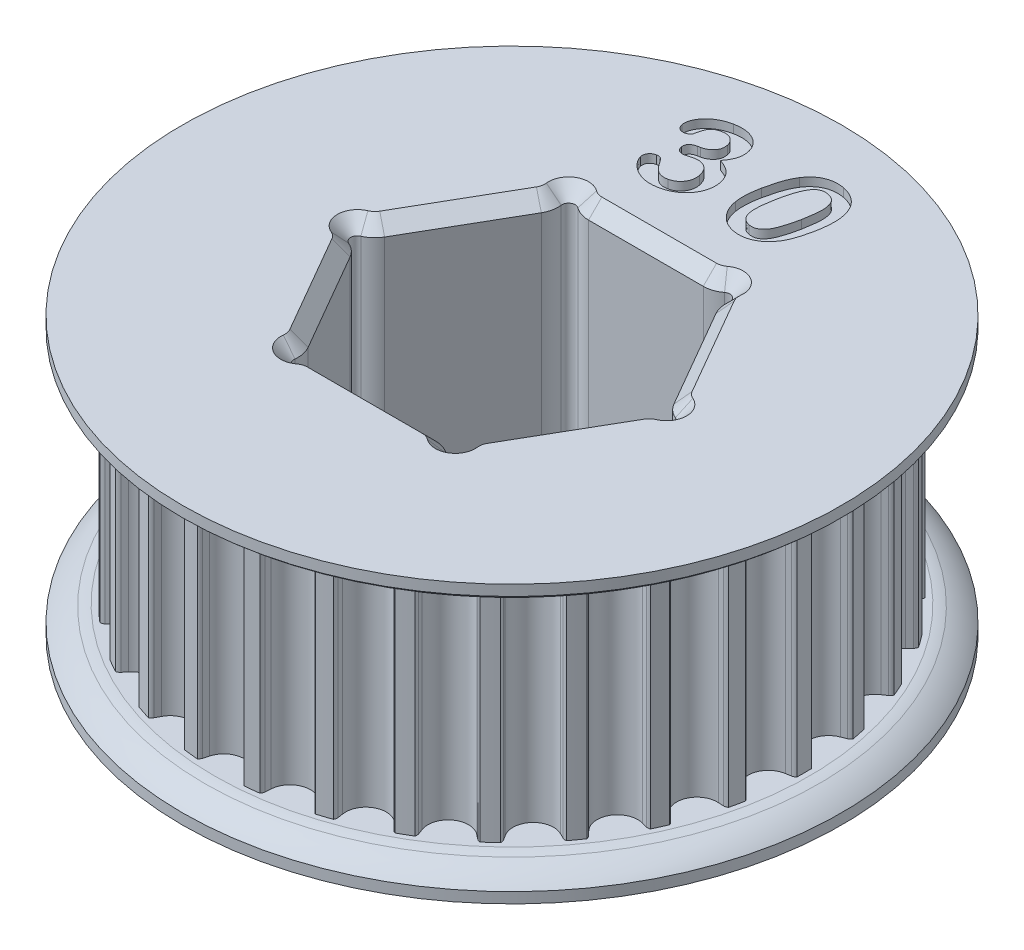
from build123d import *

# Parameters (mm, degrees)
SKETCH1_R               = 13.942945337
TOOTHOD_DEPTH           = 5.334
TOOTHPROFILE_DEPTH      = 21.427016555
TOOTHPATTERN_COUNT      = 30
BORE_DEPTH              = 24.192866588
BORE_DEPTH_BACK         = 24.192866588
LARGE_START             = 6.204
LARGE_TOOTH_COUNT_DEPTH = 0.4
SKETCH12_R              = 0.3175
CUT_EXTRUDE1_DEPTH      = 26.860153032
FILLET1_R               = 1.27
CHAMFER1_SIZE           = 0.635


# Read off the part's stored shape, not the designer's step: Large Tooth Count
with BuildPart() as part:
    # Sketch1 → ToothOD (new, symmetric)
    with BuildSketch(Plane(origin=(0, 0, 0), x_dir=(1, 0, 0), z_dir=(0, 1, 0))):
        with Locations(Location((0, 0, 0), (0, 0, 270))):
            Circle(SKETCH1_R)
    extrude(amount=TOOTHOD_DEPTH, both=True)

    # Sketch2 → ToothProfile (cut, symmetric)
    with BuildSketch(Plane(origin=(0, 0, 0), x_dir=(1, 0, 0), z_dir=(0, 1, 0))):
        with BuildLine():
            ThreePointArc((-0.937033068, 13.493007333), (-0.590385173, 12.974832723), (0, 12.774545337))
            ThreePointArc((0, 12.774545337), (0.590385173, 12.974832723), (0.937033068, 13.493007333))
            ThreePointArc((0.937033068, 13.493007333), (0.971699064, 13.619118795), (1.007805813, 13.744825337))
            ThreePointArc((1.007805813, 13.744825337), (1.04827578, 13.830028138), (1.113221937, 13.898433782))
            ThreePointArc((1.113221937, 13.898433782), (0, 13.942945337), (-1.113221937, 13.898433782))
            ThreePointArc((-1.113221937, 13.898433782), (-1.04827578, 13.830028138), (-1.007805813, 13.744825337))
            ThreePointArc((-1.007805813, 13.744825337), (-0.971699064, 13.619118795), (-0.937033068, 13.493007333))
        make_face()
    toothprofile = extrude(amount=TOOTHPROFILE_DEPTH, both=True, mode=Mode.SUBTRACT)

    # ToothPattern: ToothProfile ×30 about axis
    toothpattern_axis = Axis((0, 0, 0), (0, 1, 0))
    for i in range(1, TOOTHPATTERN_COUNT):
        add(toothprofile.rotate(toothpattern_axis, i * 360 / TOOTHPATTERN_COUNT), mode=Mode.SUBTRACT)

    # Sketch4 → Flange (revolve)
    with BuildSketch(Plane.XY, mode=Mode.PRIVATE) as flange_sk:
        with BuildLine():
            Line((0, -5.334), (14.196945337, -5.334))
            ThreePointArc((14.196945337, -5.334), (14.426591958, -5.369951298), (14.652017665, -5.426637424))
            ThreePointArc((14.652017665, -5.426637424), (15.219746242, -5.708197125), (15.720945337, -6.096))
            Line((15.720945337, -6.096), (15.720945337, -6.604))
            Line((15.720945337, -6.604), (0, -6.604))
            Line((0, -6.604), (0, -5.334))
        make_face()
        with BuildLine():
            Line((15.720945337, 6.604), (15.720945337, 6.096))
            ThreePointArc((15.720945337, 6.096), (15.219746242, 5.708197125), (14.652017665, 5.426637424))
            ThreePointArc((14.652017665, 5.426637424), (14.426591958, 5.369951298), (14.196945337, 5.334))
            Line((14.196945337, 5.334), (0, 5.334))
            Line((0, 5.334), (0, 6.604))
            Line((0, 6.604), (15.720945337, 6.604))
        make_face()
    revolve(flange_sk.sketch.rotate(Axis((0, 8.73125, 0), (0, -1, 0)), 90), axis=Axis((0, 8.73125, 0), (0, -1, 0)))

    # Sketch7 → Bore (cut, two sides: drawn at the far end of the back side and taken through both)
    with BuildSketch(Plane.XZ.offset(-BORE_DEPTH_BACK)):
        Polygon((3.688171255, 6.3881), (-3.688171255, 6.3881), (-7.376342509, 0), (-3.688171255, -6.3881), (3.688171255, -6.3881), (7.376342509, 0), align=None)
    extrude(amount=BORE_DEPTH + BORE_DEPTH_BACK, mode=Mode.SUBTRACT)

    # Large Tooth Count outline → Large Tooth Count (cut)
    # profile 1 of 2: a face of its own
    with BuildSketch(Plane(origin=(0, 0, 0), x_dir=(1, 0, 0), z_dir=(0, 1, 0)).offset(LARGE_START)):
        with BuildLine():
            add(Edge.make_bspline(
                [(3.79333125, 12.049422656), (3.80295948, 12.00370364), (3.822909298, 11.908973243), (3.839934178, 11.759322164), (3.847830972, 11.598568062), (3.845403862, 11.426870198), (3.834720655, 11.244188528), (3.813775106, 11.050562966), (3.783444974, 10.84559573), (3.75637949, 10.706002666), (3.742432031, 10.634067187)],
                knots=[0, 0, 0, 0, 0.098209665, 0.203491703, 0.316304971, 0.436495508, 0.564411761, 0.701005585, 0.845921381, 1, 1, 1, 1], degree=3))
            add(Edge.make_bspline(
                [(2.656582031, 13.166526562), (2.706206849, 13.155132675), (2.803280318, 13.132844548), (2.94259136, 13.086337807), (3.071736883, 13.028103956), (3.191370893, 12.958924604), (3.301133537, 12.879562268), (3.401403565, 12.790147143), (3.491932185, 12.691098378), (3.571195273, 12.581049527), (3.64270375, 12.462621366), (3.702802479, 12.333654233), (3.754304174, 12.195380289), (3.780133676, 12.098780354), (3.79333125, 12.049422656)],
                knots=[0, 0, 0, 0, 0.090152796, 0.176352178, 0.259651945, 0.340679802, 0.420727392, 0.499147058, 0.578272523, 0.657893561, 0.739002001, 0.822964899, 0.909543988, 1, 1, 1, 1], degree=3))
            add(Edge.make_bspline(
                [(1.173360938, 12.536090625), (1.19564708, 12.568475682), (1.239439637, 12.632112739), (1.309876572, 12.722043796), (1.385379435, 12.80326932), (1.463717976, 12.877766601), (1.546382669, 12.944036096), (1.632321887, 13.00315336), (1.721642673, 13.055310869), (1.815070316, 13.098996641), (1.911135191, 13.135579536), (2.010219263, 13.164530113), (2.111823638, 13.184843484), (2.216010824, 13.1974155), (2.322610005, 13.201900957), (2.431748708, 13.197738987), (2.543820042, 13.187862345), (2.61857504, 13.173717895), (2.656582031, 13.166526562)],
                knots=[0, 0, 0, 0, 0.068450482, 0.134506083, 0.198696985, 0.261397333, 0.32259497, 0.382979431, 0.44289939, 0.502488886, 0.562366234, 0.621745712, 0.682025526, 0.742587693, 0.804322948, 0.86759274, 0.932681402, 1, 1, 1, 1], degree=3))
            add(Edge.make_bspline(
                [(0.702766406, 11.194851563), (0.717518862, 11.26519424), (0.746304912, 11.402451919), (0.795571225, 11.601658214), (0.847978183, 11.789071165), (0.90385964, 11.964480499), (0.96446555, 12.126861213), (1.028594768, 12.276407029), (1.09639016, 12.412817483), (1.14831297, 12.495974859), (1.173360938, 12.536090625)],
                knots=[0, 0, 0, 0, 0.150859184, 0.294367262, 0.430657714, 0.559291409, 0.680684962, 0.794312984, 0.900774981, 1, 1, 1, 1], degree=3))
            add(Edge.make_bspline(
                [(0.644723437, 10.008096094), (0.638642526, 10.051800398), (0.62630634, 10.140462185), (0.615500251, 10.276683221), (0.613264488, 10.417696474), (0.617724523, 10.563713236), (0.629736602, 10.714706791), (0.647630451, 10.870765397), (0.671603874, 11.031631495), (0.692265669, 11.139851826), (0.702766406, 11.194851563)],
                knots=[0, 0, 0, 0, 0.110816528, 0.224810611, 0.342958202, 0.464879995, 0.591603543, 0.723291302, 0.859371106, 1, 1, 1, 1], degree=3))
            add(Edge.make_bspline(
                [(1.794867187, 8.76061875), (1.757796481, 8.76895007), (1.68470395, 8.785376984), (1.578692012, 8.82022096), (1.476675673, 8.860522245), (1.379895209, 8.910638347), (1.286656653, 8.96627254), (1.199065463, 9.031260904), (1.11583816, 9.102909474), (1.037001008, 9.181177406), (0.965366205, 9.26703746), (0.89879616, 9.357482146), (0.838782928, 9.453126056), (0.786187527, 9.554158241), (0.740572541, 9.660223984), (0.701101372, 9.771069082), (0.668904031, 9.887535787), (0.652864919, 9.96750406), (0.644723437, 10.008096094)],
                knots=[0, 0, 0, 0, 0.063013357, 0.124243807, 0.184962126, 0.244824632, 0.304882435, 0.36494633, 0.425537954, 0.487006996, 0.549046882, 0.61088984, 0.673245472, 0.736208478, 0.799702013, 0.864689897, 0.931316357, 1, 1, 1, 1], degree=3))
            add(Edge.make_bspline(
                [(3.180754687, 9.264253125), (3.157871319, 9.238339502), (3.112408772, 9.186856728), (3.039152131, 9.116067869), (2.9637652, 9.050064281), (2.885426692, 8.990658812), (2.8048367, 8.936587878), (2.721160657, 8.88907576), (2.63496381, 8.847278953), (2.517451736, 8.799676867), (2.365781878, 8.756326636), (2.178312896, 8.730516303), (1.986365835, 8.729537419), (1.859281577, 8.750163925), (1.794867187, 8.76061875)],
                knots=[0, 0, 0, 0, 0.066903371, 0.132917389, 0.197045886, 0.260779646, 0.323109482, 0.384791342, 0.446902374, 0.508430619, 0.630088147, 0.75110531, 0.873844332, 1, 1, 1, 1], degree=3))
            add(Edge.make_bspline(
                [(3.742432031, 10.634067187), (3.726295378, 10.558340978), (3.695171685, 10.412283466), (3.641678743, 10.203431187), (3.584650967, 10.012311882), (3.523425044, 9.837691486), (3.454100306, 9.677001753), (3.374462336, 9.528516449), (3.284684763, 9.389781631), (3.215227641, 9.305890142), (3.180754687, 9.264253125)],
                knots=[0, 0, 0, 0, 0.155098438, 0.29914731, 0.431769474, 0.554551464, 0.669651875, 0.781967595, 0.891786174, 1, 1, 1, 1], degree=3))
        make_face()
        with BuildLine():
            add(Edge.make_bspline(
                [(1.913632031, 9.391054688), (1.936191106, 9.38694552), (1.980185713, 9.37893184), (2.045763475, 9.376169625), (2.108911071, 9.377120318), (2.169393074, 9.386316528), (2.227667826, 9.401443932), (2.282542724, 9.423991977), (2.335506687, 9.451969145), (2.403091961, 9.499508781), (2.481822438, 9.575759873), (2.568295205, 9.6856682), (2.644534424, 9.81897376), (2.700601492, 9.944710055), (2.743549964, 10.056346982), (2.775688425, 10.14928192), (2.806502535, 10.249549545), (2.83842757, 10.356386286), (2.8666493, 10.470972631), (2.898301591, 10.591595098), (2.925859938, 10.719988705), (2.944440044, 10.807895221), (2.953940625, 10.852844531)],
                knots=[0, 0, 0, 0, 0.034322192, 0.066934986, 0.09817343, 0.128833214, 0.15837243, 0.188193233, 0.21752966, 0.247971246, 0.311715644, 0.380966107, 0.456937588, 0.541184412, 0.5870788, 0.636172085, 0.688515898, 0.744276078, 0.803241566, 0.865343089, 0.931145772, 1, 1, 1, 1], degree=3))
            add(Edge.make_bspline(
                [(1.519832813, 11.11805625), (1.511017323, 11.074037933), (1.493773916, 10.98793656), (1.471625542, 10.861374205), (1.452620291, 10.740537153), (1.437576544, 10.625256237), (1.425232976, 10.51569431), (1.414584888, 10.411887693), (1.409872652, 10.313826042), (1.405715218, 10.193850961), (1.409976085, 10.055502488), (1.432295682, 9.903419688), (1.467453367, 9.768934219), (1.520446003, 9.652923922), (1.590923619, 9.555124537), (1.681918125, 9.47873684), (1.790886115, 9.421901023), (1.871680589, 9.401597183), (1.913632031, 9.391054688)],
                knots=[0, 0, 0, 0, 0.068200355, 0.133402288, 0.195185331, 0.254025261, 0.31000668, 0.362698789, 0.412516234, 0.459113992, 0.545092877, 0.622348653, 0.692232855, 0.755558915, 0.815072705, 0.873785642, 0.934464896, 1, 1, 1, 1], degree=3))
            add(Edge.make_bspline(
                [(2.542282031, 12.535197656), (2.510228965, 12.540610223), (2.447897413, 12.551135695), (2.355155361, 12.55080467), (2.267169473, 12.538045332), (2.185158847, 12.509404991), (2.107646091, 12.469091598), (2.037103622, 12.413069325), (1.969950233, 12.345664248), (1.909739947, 12.262917379), (1.852355154, 12.167472424), (1.79856556, 12.058011501), (1.745774289, 11.935645626), (1.69597424, 11.798941812), (1.64794977, 11.64852004), (1.602960636, 11.483881359), (1.558685897, 11.305992894), (1.533083611, 11.182151822), (1.519832813, 11.11805625)],
                knots=[0, 0, 0, 0, 0.049883832, 0.097005903, 0.141910465, 0.185891973, 0.229892514, 0.27555509, 0.323757438, 0.375729045, 0.432377302, 0.494779801, 0.563021864, 0.637130541, 0.718298347, 0.805651304, 0.899412281, 1, 1, 1, 1], degree=3))
            add(Edge.make_bspline(
                [(2.953940625, 10.852844531), (2.970100217, 10.936663066), (3.000891971, 11.096377469), (3.034227598, 11.326082692), (3.054181678, 11.533507079), (3.062586089, 11.719587665), (3.05642304, 11.885890677), (3.034730753, 12.033797688), (2.997872968, 12.164190151), (2.944472978, 12.277221692), (2.872316409, 12.372256405), (2.780543414, 12.448028722), (2.668852714, 12.504640553), (2.585717069, 12.524711429), (2.542282031, 12.535197656)],
                knots=[0, 0, 0, 0, 0.132037801, 0.251595171, 0.358900261, 0.454285871, 0.539549896, 0.615937084, 0.685005529, 0.748434951, 0.808205655, 0.86804549, 0.931059066, 1, 1, 1, 1], degree=3))
        make_face(mode=Mode.SUBTRACT)
    # profile 2 of 2: a face of its own
    with BuildSketch(Plane(origin=(0, 0, 0), x_dir=(1, 0, 0), z_dir=(0, 1, 0)).offset(LARGE_START)):
        with BuildLine():
            add(Edge.make_bspline(
                [(-2.907567822, 10.987652963), (-2.911020111, 11.0117193), (-2.917671531, 11.058087185), (-2.909874272, 11.12733624), (-2.888474163, 11.192085305), (-2.850548449, 11.251221072), (-2.797912661, 11.303833895), (-2.728632533, 11.346660506), (-2.645208595, 11.381637982), (-2.583123729, 11.395547556), (-2.550380322, 11.402883432)],
                knots=[0, 0, 0, 0, 0.117439719, 0.226267565, 0.334404554, 0.445288529, 0.563637655, 0.692116396, 0.837622945, 1, 1, 1, 1], degree=3))
            add(Edge.make_bspline(
                [(-2.50216001, 10.734942807), (-2.527973056, 10.730888299), (-2.577047848, 10.723180021), (-2.649199277, 10.724266576), (-2.714239947, 10.739555135), (-2.772002705, 10.766694832), (-2.821456645, 10.805967518), (-2.860822936, 10.85700761), (-2.891202858, 10.918311476), (-2.901945548, 10.963830309), (-2.907567822, 10.987652963)],
                knots=[0, 0, 0, 0, 0.144370241, 0.274471271, 0.396265647, 0.511142994, 0.624786851, 0.742034498, 0.864991642, 1, 1, 1, 1], degree=3))
            add(Edge.make_bspline(
                [(-2.164617822, 10.826918588), (-2.17565662, 10.8246444), (-2.20055828, 10.819514218), (-2.241434525, 10.808233563), (-2.290749354, 10.795261624), (-2.344285921, 10.778595394), (-2.396920901, 10.763963975), (-2.441224432, 10.74997546), (-2.475255472, 10.741016464), (-2.494412337, 10.736691831), (-2.50216001, 10.734942807)],
                knots=[0, 0, 0, 0, 0.096592829, 0.217897078, 0.363363739, 0.53371412, 0.698449031, 0.831649283, 0.931913378, 1, 1, 1, 1], degree=3))
            add(Edge.make_bspline(
                [(-1.301117041, 10.242917025), (-1.307193042, 10.270426788), (-1.319078446, 10.324239262), (-1.344395643, 10.400845048), (-1.373721462, 10.472174756), (-1.408552622, 10.537307788), (-1.448138758, 10.596962589), (-1.492718946, 10.650911137), (-1.543296187, 10.698240919), (-1.597791303, 10.740449525), (-1.65650148, 10.776492507), (-1.719650926, 10.803805257), (-1.785369718, 10.825463875), (-1.854654836, 10.841158103), (-1.927836848, 10.847780177), (-2.003990776, 10.847430107), (-2.08350986, 10.841478355), (-2.137002976, 10.831875755), (-2.164617822, 10.826918588)],
                knots=[0, 0, 0, 0, 0.071431919, 0.139729604, 0.204381507, 0.26688073, 0.326780298, 0.385758869, 0.443983301, 0.502134232, 0.560412505, 0.618224132, 0.676252356, 0.735798644, 0.79801438, 0.862201554, 0.928864065, 1, 1, 1, 1], degree=3))
            add(Edge.make_bspline(
                [(-1.894048291, 9.334767807), (-1.864034942, 9.342019437), (-1.803997056, 9.356525402), (-1.718095519, 9.392549277), (-1.63500257, 9.436859605), (-1.557697471, 9.493553506), (-1.485897505, 9.559355048), (-1.42299477, 9.635466912), (-1.371273193, 9.721676475), (-1.328044272, 9.815001877), (-1.297540124, 9.915869027), (-1.282251505, 10.022090362), (-1.283288558, 10.132227454), (-1.295093074, 10.205516743), (-1.301117041, 10.242917025)],
                knots=[0, 0, 0, 0, 0.076639119, 0.153306805, 0.2307807, 0.310256727, 0.390888456, 0.472361089, 0.554715906, 0.640137892, 0.727448796, 0.81565797, 0.905928356, 1, 1, 1, 1], degree=3))
            add(Edge.make_bspline(
                [(-2.879885791, 9.966989682), (-2.842161736, 9.908262428), (-2.770950625, 9.797403906), (-2.655412662, 9.650785089), (-2.54596033, 9.527581873), (-2.451776394, 9.444971426), (-2.375369029, 9.393354819), (-2.315693796, 9.364105015), (-2.253411391, 9.340303937), (-2.187200301, 9.32571391), (-2.118488066, 9.316115802), (-2.046352828, 9.316180502), (-1.971002158, 9.320986547), (-1.92017782, 9.330088408), (-1.894048291, 9.334767807)],
                knots=[0, 0, 0, 0, 0.165494384, 0.312401169, 0.442363846, 0.556028008, 0.608516533, 0.660623665, 0.713353888, 0.766282329, 0.82111266, 0.877609238, 0.937077136, 1, 1, 1, 1], degree=3))
            add(Edge.make_bspline(
                [(-3.171886572, 10.069681088), (-3.14385434, 10.073198771), (-3.086866668, 10.080349987), (-3.016159411, 10.062377337), (-2.963653751, 10.040866753), (-2.929245884, 10.020200304), (-2.900553642, 9.996098825), (-2.886665266, 9.976538072), (-2.879885791, 9.966989682)],
                knots=[0, 0, 0, 0, 0.25801308, 0.524523507, 0.658326607, 0.779999686, 0.892608999, 1, 1, 1, 1], degree=3))
            add(Edge.make_bspline(
                [(-3.484425635, 9.618731869), (-3.488513103, 9.645754524), (-3.496408536, 9.697952022), (-3.48974961, 9.775572612), (-3.468299589, 9.848133199), (-3.429821823, 9.91311879), (-3.380453131, 9.970640358), (-3.31883733, 10.015524204), (-3.249260159, 10.05065411), (-3.198127535, 10.063228159), (-3.171886572, 10.069681088)],
                knots=[0, 0, 0, 0, 0.132938278, 0.256786215, 0.37668058, 0.498977948, 0.622467818, 0.743865292, 0.868553173, 1, 1, 1, 1], degree=3))
            add(Edge.make_bspline(
                [(-1.785106104, 8.762374838), (-1.842999642, 8.752308355), (-1.956153802, 8.732633199), (-2.125300666, 8.722845227), (-2.288444786, 8.730704508), (-2.444641373, 8.755666495), (-2.591695194, 8.795800035), (-2.729678863, 8.843977586), (-2.856373936, 8.904247923), (-2.971592963, 8.974130076), (-3.075959637, 9.05099133), (-3.169580085, 9.132350915), (-3.253766646, 9.216384507), (-3.32505813, 9.303984015), (-3.384238734, 9.390405459), (-3.430828516, 9.471567902), (-3.466028682, 9.546153589), (-3.478556953, 9.595579184), (-3.484425635, 9.618731869)],
                knots=[0, 0, 0, 0, 0.084858105, 0.165856982, 0.244232561, 0.320459077, 0.393907119, 0.464241528, 0.531385461, 0.596223663, 0.658678463, 0.718440469, 0.775314216, 0.830331254, 0.881391247, 0.926470742, 0.965556313, 1, 1, 1, 1], degree=3))
            add(Edge.make_bspline(
                [(-0.510839697, 10.452764682), (-0.503345139, 10.408226317), (-0.4883779, 10.319279609), (-0.482909614, 10.183935204), (-0.489690789, 10.048099299), (-0.511439263, 9.912933302), (-0.545857927, 9.779535454), (-0.595588259, 9.650001857), (-0.659364222, 9.524844107), (-0.736159432, 9.404060105), (-0.826203591, 9.290058739), (-0.928884195, 9.183964629), (-1.043609397, 9.086335449), (-1.17039691, 8.998137733), (-1.308403836, 8.920151261), (-1.457259536, 8.854056962), (-1.616837008, 8.799845892), (-1.72827521, 8.775030242), (-1.785106104, 8.762374838)],
                knots=[0, 0, 0, 0, 0.057352876, 0.11453832, 0.171742531, 0.229957309, 0.28822369, 0.346537948, 0.405922237, 0.466475902, 0.528158226, 0.590227966, 0.653829397, 0.719315559, 0.786228555, 0.854984433, 0.926045431, 1, 1, 1, 1], degree=3))
            add(Edge.make_bspline(
                [(-1.420774854, 11.3609139), (-1.379768236, 11.34753806), (-1.299429209, 11.321332485), (-1.185212143, 11.272428436), (-1.07793184, 11.219447087), (-0.980039443, 11.158069696), (-0.888760645, 11.092819194), (-0.808706982, 11.018421497), (-0.735057632, 10.940254777), (-0.673108733, 10.853530761), (-0.617889125, 10.762256205), (-0.572376758, 10.664699496), (-0.53634402, 10.561034633), (-0.519434889, 10.489252654), (-0.510839697, 10.452764682)],
                knots=[0, 0, 0, 0, 0.095378747, 0.186863396, 0.274624743, 0.359785527, 0.4422375, 0.522414957, 0.60117637, 0.67941575, 0.757680067, 0.836927252, 0.917107413, 1, 1, 1, 1], degree=3))
            add(Edge.make_bspline(
                [(-1.113593604, 12.373540463), (-1.105535205, 12.326056531), (-1.089847899, 12.233619444), (-1.087064846, 12.096209008), (-1.10318767, 11.966079741), (-1.137133506, 11.842223594), (-1.187816437, 11.722295891), (-1.251857629, 11.602129272), (-1.329803096, 11.480501796), (-1.38984058, 11.401578881), (-1.420774854, 11.3609139)],
                knots=[0, 0, 0, 0, 0.131486853, 0.25596578, 0.374011465, 0.488659132, 0.6057311, 0.729086035, 0.860411758, 1, 1, 1, 1], degree=3))
            add(Edge.make_bspline(
                [(-2.607530322, 13.176319369), (-2.560603325, 13.184752448), (-2.468650078, 13.20127703), (-2.331284582, 13.213858274), (-2.198353877, 13.214855069), (-2.069985509, 13.204798226), (-1.946984279, 13.185861458), (-1.829771384, 13.155139566), (-1.719053842, 13.114235668), (-1.615102318, 13.063050887), (-1.518700327, 13.003374449), (-1.430328654, 12.93552939), (-1.352606305, 12.858275837), (-1.284327418, 12.773647035), (-1.225348563, 12.68281314), (-1.17672779, 12.585531492), (-1.138776026, 12.482117817), (-1.12206508, 12.410066355), (-1.113593604, 12.373540463)],
                knots=[0, 0, 0, 0, 0.075293483, 0.147537249, 0.217601167, 0.285040851, 0.350750214, 0.413934509, 0.476124159, 0.53689869, 0.596660669, 0.654975167, 0.712497532, 0.76933742, 0.826464438, 0.883242051, 0.940810524, 1, 1, 1, 1], degree=3))
            add(Edge.make_bspline(
                [(-3.81661001, 11.923484213), (-3.820713069, 11.949317661), (-3.82912174, 12.002259868), (-3.825988998, 12.084997352), (-3.813497883, 12.171602749), (-3.788966362, 12.261717468), (-3.753270358, 12.35412112), (-3.706109395, 12.44738096), (-3.649175891, 12.541355345), (-3.579871049, 12.634043286), (-3.500140483, 12.725822586), (-3.405607276, 12.810642647), (-3.300478307, 12.892097866), (-3.182717222, 12.966231518), (-3.054293041, 13.034665661), (-2.914447958, 13.092169923), (-2.764942756, 13.140962351), (-2.660737865, 13.164368216), (-2.607530322, 13.176319369)],
                knots=[0, 0, 0, 0, 0.041089621, 0.084207698, 0.129665656, 0.178652453, 0.230863189, 0.285345725, 0.342963863, 0.403597209, 0.4673357, 0.533998714, 0.60316391, 0.676475843, 0.752769812, 0.831957136, 0.914196467, 1, 1, 1, 1], degree=3))
            add(Edge.make_bspline(
                [(-3.43084751, 11.641306088), (-3.450471699, 11.638213026), (-3.48975346, 11.632021642), (-3.549812, 11.641049399), (-3.610068952, 11.658568392), (-3.668184834, 11.690064549), (-3.721793815, 11.732167268), (-3.765672035, 11.786397222), (-3.798386954, 11.851002048), (-3.810394163, 11.898760696), (-3.81661001, 11.923484213)],
                knots=[0, 0, 0, 0, 0.111646881, 0.223483692, 0.339493462, 0.465162893, 0.594417733, 0.722363323, 0.856274089, 1, 1, 1, 1], degree=3))
            add(Edge.make_bspline(
                [(-3.170100635, 11.813649057), (-3.173833151, 11.803604749), (-3.181378645, 11.783299604), (-3.201539595, 11.755758234), (-3.22755316, 11.730025822), (-3.271578939, 11.697463058), (-3.339271403, 11.663565469), (-3.399190782, 11.649000881), (-3.43084751, 11.641306088)],
                knots=[0, 0, 0, 0, 0.098163881, 0.198443932, 0.310752569, 0.433981497, 0.700959954, 1, 1, 1, 1], degree=3))
            add(Edge.make_bspline(
                [(-2.574490479, 12.587852963), (-2.603203999, 12.581524652), (-2.657948149, 12.569459325), (-2.734616678, 12.543950399), (-2.802654694, 12.515241124), (-2.861400447, 12.480798629), (-2.91176693, 12.443041018), (-2.955331162, 12.402437575), (-2.992180849, 12.35880138), (-3.032665066, 12.294097151), (-3.072701742, 12.199823524), (-3.109088165, 12.075055138), (-3.14020504, 11.943902763), (-3.160328727, 11.856224801), (-3.170100635, 11.813649057)],
                knots=[0, 0, 0, 0, 0.08290668, 0.158066849, 0.227652368, 0.290886539, 0.349675616, 0.404933264, 0.45859134, 0.510315093, 0.619720685, 0.746177872, 0.876745925, 1, 1, 1, 1], degree=3))
            add(Edge.make_bspline(
                [(-1.885118604, 12.163692807), (-1.894174968, 12.198992158), (-1.912021457, 12.268553123), (-1.962337537, 12.364149206), (-2.032066353, 12.446711136), (-2.117619011, 12.516044357), (-2.216854245, 12.569606088), (-2.328403516, 12.600247012), (-2.449742189, 12.60727195), (-2.53175235, 12.594505809), (-2.574490479, 12.587852963)],
                knots=[0, 0, 0, 0, 0.120495419, 0.23744849, 0.354430692, 0.476475465, 0.600506251, 0.725467584, 0.856932341, 1, 1, 1, 1], degree=3))
            add(Edge.make_bspline(
                [(-2.429829541, 11.427886557), (-2.386199616, 11.438323972), (-2.301039196, 11.458696565), (-2.183175442, 11.513588531), (-2.079238486, 11.586023186), (-2.004181225, 11.659532755), (-1.95384716, 11.726215117), (-1.922515471, 11.779793005), (-1.898004748, 11.836718375), (-1.881147238, 11.896790031), (-1.871314177, 11.959737259), (-1.868760103, 12.025331892), (-1.873436351, 12.093805214), (-1.881147102, 12.139933804), (-1.885118604, 12.163692807)],
                knots=[0, 0, 0, 0, 0.13045338, 0.254629467, 0.376126556, 0.498167231, 0.55887707, 0.619120502, 0.678565805, 0.738965105, 0.800419954, 0.863785083, 0.929841114, 1, 1, 1, 1], degree=3))
            Line((-2.429829541, 11.427886557), (-2.550380322, 11.402883432))
        make_face()
    extrude(amount=LARGE_TOOTH_COUNT_DEPTH, mode=Mode.SUBTRACT)

    # Sketch12 → Cut-Extrude1 (cut, through all)
    with BuildSketch(Plane(origin=(0, 6.604, 0), x_dir=(1, 0, 0), z_dir=(0, 1, 0))):
        with Locations((-3.688171255, 6.3881)):
            Circle(SKETCH12_R)
        with Locations((3.688171255, 6.3881)):
            Circle(SKETCH12_R)
        with Locations((7.376342509, 0)):
            Circle(SKETCH12_R)
        with Locations((3.688171255, -6.3881)):
            Circle(SKETCH12_R)
        with Locations((-3.688171255, -6.3881)):
            Circle(SKETCH12_R)
        with Locations((-7.376342509, 0)):
            Circle(SKETCH12_R)
    extrude(amount=-CUT_EXTRUDE1_DEPTH, mode=Mode.SUBTRACT)

    # Fillet1
    fillet1_edges = [part.edges().sort_by_distance(p)[0] for p in [
        (3.370671255, 0, 6.3881),
        (-3.370671255, 0, 6.3881),
        (-7.217592509, 0, 0.274963066),
        (-3.846921255, 0, -6.113136934),
        (3.370671255, 0, -6.3881),
        (7.217592509, 0, -0.274963066),
        (-7.217592509, 0, -0.274963066),
        (-3.846921255, 0, 6.113136934),
        (3.846921255, 0, 6.113136934),
        (7.217592509, 0, 0.274963066),
        (3.846921255, 0, -6.113136934),
        (-3.370671255, 0, -6.3881),
    ]]
    fillet(fillet1_edges, radius=FILLET1_R)

    # Chamfer1
    chamfer1_edges = [part.edges().sort_by_distance(p)[0] for p in [
        (-5.532256882, 6.604, -3.19405),
        (-5.532256882, -6.604, -3.19405),
        (-7.693842509, -6.604, 0),
        (-5.532256882, -6.604, 3.19405),
        (-3.846921255, -6.604, 6.663063066),
        (0, -6.604, 6.3881),
        (3.846921255, -6.604, 6.663063066),
        (5.532256882, -6.604, 3.19405),
        (7.693842509, -6.604, 0),
        (5.532256882, -6.604, -3.19405),
        (3.846921255, -6.604, -6.663063066),
        (0, -6.604, -6.3881),
        (-3.846921255, -6.604, -6.663063066),
        (-3.137280517, -6.604, -6.453272211),
        (-4.020057414, -6.604, -5.943600733),
        (3.137280517, -6.604, -6.453272211),
        (4.020057414, -6.604, -5.943600733),
        (7.157337931, -6.604, -0.509671479),
        (7.157337931, -6.604, 0.509671479),
        (3.137280517, -6.604, 6.453272211),
        (4.020057414, -6.604, 5.943600733),
        (-3.137280517, -6.604, 6.453272211),
        (-4.020057414, -6.604, 5.943600733),
        (-7.157337931, -6.604, 0.509671479),
        (-7.157337931, -6.604, -0.509671479),
        (-7.693842509, 6.604, 0),
        (-5.532256882, 6.604, 3.19405),
        (-3.846921255, 6.604, -6.663063066),
        (0, 6.604, -6.3881),
        (3.846921255, 6.604, -6.663063066),
        (5.532256882, 6.604, -3.19405),
        (7.693842509, 6.604, 0),
        (5.532256882, 6.604, 3.19405),
        (3.846921255, 6.604, 6.663063066),
        (0, 6.604, 6.3881),
        (-3.846921255, 6.604, 6.663063066),
        (-3.137280517, 6.604, -6.453272211),
        (-4.020057414, 6.604, -5.943600733),
        (3.137280517, 6.604, -6.453272211),
        (4.020057414, 6.604, -5.943600733),
        (7.157337931, 6.604, -0.509671479),
        (7.157337931, 6.604, 0.509671479),
        (3.137280517, 6.604, 6.453272211),
        (4.020057414, 6.604, 5.943600733),
        (-3.137280517, 6.604, 6.453272211),
        (-4.020057414, 6.604, 5.943600733),
        (-7.157337931, 6.604, 0.509671479),
        (-7.157337931, 6.604, -0.509671479),
    ]]
    chamfer(chamfer1_edges, length=CHAMFER1_SIZE)


solid = part.part
